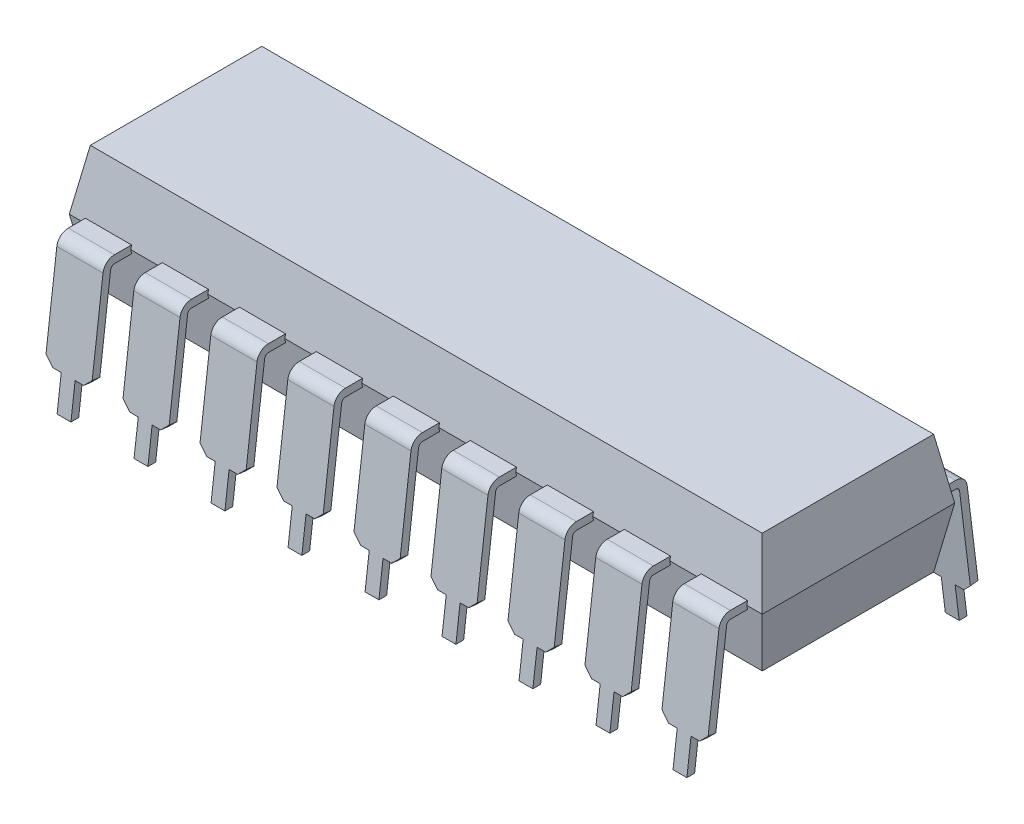
from build123d import *
from build123d.topology import SkipClean

# Parameters (mm, degrees)
SKETCH1_W                        = 22.86
SKETCH1_H                        = 6.35
BASE_EXTRUSION_DEPTH             = 1.9685
BASE_EXTRUSION_TAPER             = 10
BASE_EXTRUSION_OTHER_WAY_DEPTH   = 1.9685
BASE_EXTRUSION_OTHER_WAY_TAPER   = 10
LEG_START                        = 10.16
LEG_DEPTH                        = 0.2286
LEG_SHOULDER_DEPTH               = 0.762
LEG_CHAMFERS_SIZE                = 0.25
LEG_PATTERN_COUNT                = 9
LEG_PATTERN_PITCH                = 2.54
LEG_CHAMFERS_OF_LEG_PATTERN_SIZE = 0.25


# Read off the part's stored shape, not the designer's step: Leg Mirror
with BuildPart() as part:
    # Sketch1 → Base Extrusion (new body)
    with BuildSketch(Plane(origin=(0, 0, 0), x_dir=(1, 0, 0), z_dir=(0, 1, 0))):
        Rectangle(SKETCH1_W, SKETCH1_H)
    extrude(amount=BASE_EXTRUSION_DEPTH, taper=BASE_EXTRUSION_TAPER)

    # Sketch1 → Base Extrusion other way (add)
    with BuildSketch(Plane(origin=(0, 0, 0), x_dir=(1, 0, 0), z_dir=(0, 1, 0))):
        Rectangle(SKETCH1_W, SKETCH1_H)
    extrude(amount=-BASE_EXTRUSION_OTHER_WAY_DEPTH, taper=BASE_EXTRUSION_OTHER_WAY_TAPER)

    # Sketch2 → Leg (add, symmetric)
    with BuildSketch(Plane(origin=(0, 0, 0), x_dir=(0, 0, -1), z_dir=(1, 0, 0)).offset(LEG_START)):
        with BuildLine():
            Line((0, 0.127), (-3.71665493, 0.127))
            ThreePointArc((-3.71665493, 0.127), (-3.969059539, 0.031399568), (-4.094797535, -0.207425652))
            Line((-4.094797535, -0.207425652), (-4.888547535, -6.651975217))
            Line((-4.888547535, -6.651975217), (-4.636452465, -6.683024783))
            Line((-4.636452465, -6.683024783), (-3.842702465, -0.238475217))
            ThreePointArc((-3.842702465, -0.238475217), (-3.800789799, -0.158866811), (-3.71665493, -0.127))
            Line((-3.71665493, -0.127), (0, -0.127))
            Line((0, -0.127), (0, 0.127))
        make_face()
    leg = extrude(amount=LEG_DEPTH, both=True)

    # Sketch3 → Leg Shoulder (add, symmetric)
    with SkipClean():  # the faces are left unmerged after this step: merging them gives an invalid solid
        with BuildSketch(Plane(origin=(0, 0, 0), x_dir=(0, 0, -1), z_dir=(1, 0, 0)).offset(LEG_START)):
            with BuildLine():
                Line((0, 0.127), (0, -0.127))
                Line((0, -0.127), (-3.71665493, -0.127))
                ThreePointArc((-3.71665493, -0.127), (-3.800789799, -0.158866811), (-3.842702465, -0.238475217))
                Line((-3.842702465, -0.238475217), (-4.229758021, -3.381024783))
                Line((-4.229758021, -3.381024783), (-4.481853092, -3.349975217))
                Line((-4.481853092, -3.349975217), (-4.094797535, -0.207425652))
                ThreePointArc((-4.094797535, -0.207425652), (-3.969059539, 0.031399568), (-3.71665493, 0.127))
                Line((-3.71665493, 0.127), (0, 0.127))
            make_face()
        leg_shoulder = extrude(amount=LEG_SHOULDER_DEPTH, both=True)
    add(part.part.scale(1), mode=Mode.REPLACE)  # the faces are merged on a copy

    # Leg Chamfers
    leg_chamfers_edges = [part.edges().sort_by_distance(p)[0] for p in [
        (9.398, -3.3655, 4.355805556),
        (10.922, -3.3655, 4.355805556),
    ]]
    chamfer(leg_chamfers_edges, length=LEG_CHAMFERS_SIZE)

    # Leg Pattern: Leg, Leg Shoulder ×9
    with Locations(*[(-i * LEG_PATTERN_PITCH, 0, 0) for i in range(1, LEG_PATTERN_COUNT)]):
        add(leg)
        add(leg_shoulder)

    # Leg Chamfers of Leg Pattern
    leg_chamfers_of_leg_pattern_edges = [part.edges().sort_by_distance(p)[0] for p in [
        (6.858, -3.3655, 4.355805556),
        (8.382, -3.3655, 4.355805556),
        (4.318, -3.3655, 4.355805556),
        (5.842, -3.3655, 4.355805556),
        (1.778, -3.3655, 4.355805556),
        (3.302, -3.3655, 4.355805556),
        (-0.762, -3.3655, 4.355805556),
        (0.762, -3.3655, 4.355805556),
        (-3.302, -3.3655, 4.355805556),
        (-1.778, -3.3655, 4.355805556),
        (-5.842, -3.3655, 4.355805556),
        (-4.318, -3.3655, 4.355805556),
        (-8.382, -3.3655, 4.355805556),
        (-6.858, -3.3655, 4.355805556),
        (-10.922, -3.3655, 4.355805556),
        (-9.398, -3.3655, 4.355805556),
    ]]
    chamfer(leg_chamfers_of_leg_pattern_edges, length=LEG_CHAMFERS_OF_LEG_PATTERN_SIZE)

    # Leg Mirror: part across plane


with BuildPart() as part_1:
    add(part.part)
    add(part.part.mirror(Plane.XY))

    # Leg Trim
    split(bisect_by=Plane(origin=(0, -4.4685, 0), x_dir=(-1, 0, 0), z_dir=(0, -1, 0)), keep=Keep.BOTTOM)


solid = part_1.part
